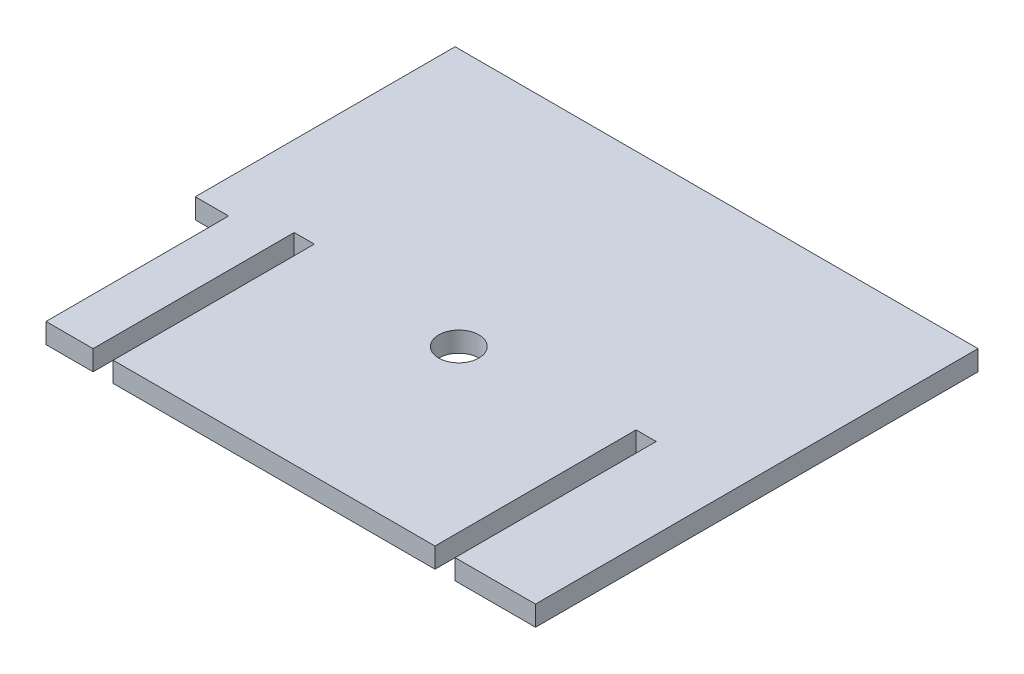
from build123d import *

# Parameters (mm, degrees)
BOSS_EXTRUDE1_DEPTH = 12.7
CAVITY1_START       = 298.45
CAVITY1_OUTLINE_R   = 12.7
CAVITY1_DEPTH       = 12.7
CAVITY1_START_2     = 720.91620239
CAVITY1_2_DEPTH     = 22.43918751
SKETCH2_W           = 21.068746236
SKETCH2_H           = 115.32536453
CUT_EXTRUDE1_DEPTH  = 1143.349273427


# Read off the part's stored shape, not the designer's step: Cavity1
with BuildPart() as part:
    # Sketch1 → Boss-Extrude1 (new body)
    with BuildSketch(Plane(origin=(0, 298.45, 0), x_dir=(-1, 0, 0), z_dir=(0, -1, 0))):
        Polygon((-798.4, 260.35), (-798.4, 133.35), (-1001.6, 133.35), (-1001.6, 260.35), (-1014.3, 260.35), (-1014.3, 133.35), (-1065.1, 133.35), (-1065.1, 412.75), (-1014.3, 412.75), (-1001.6, 412.75), (-798.4, 412.75), (-785.7, 412.75), (-734.9, 412.75), (-734.9, 133.35), (-785.7, 133.35), (-785.7, 260.35), align=None)
    extrude(amount=-BOSS_EXTRUDE1_DEPTH)

    # Cavity1 outline → Cavity1 (cut)
    with BuildSketch(Plane(origin=(0, 0, 0), x_dir=(1, 0, 0), z_dir=(0, 1, 0)).offset(CAVITY1_START)):
        with Locations((900, 250)):
            Circle(CAVITY1_OUTLINE_R)
    extrude(amount=CAVITY1_DEPTH, mode=Mode.SUBTRACT)

    # Cavity1 2 outline → Cavity1 2 (cut)
    with BuildSketch(Plane(origin=(0, 0, 0), x_dir=(0.7149295353100682, -0.6987525164445135, -0.024913456279483565), z_dir=(0.6991965099607762, 0.7144755512387232, 0.02547404837855681)).offset(CAVITY1_START_2)):
        with BuildLine():
            ThreePointArc((313.444242413, 230.081087528), (327.146171675, 242.424687318), (314.076314529, 255.435688643))
            Line((314.076314529, 255.435688643), (312, 255.374549574))
            Line((312, 255.374549574), (312, 230.195835843))
            Line((312, 230.195835843), (313.444242413, 230.081087528))
        make_face()
    extrude(amount=CAVITY1_2_DEPTH, mode=Mode.SUBTRACT)

    # Sketch2 → Cut-Extrude1 (cut, through all)
    with BuildSketch(Plane(origin=(0, 311.15, 0), x_dir=(1, 0, 0), z_dir=(0, 1, 0))):
        with Locations((745.434373118, 191.012682265)):
            Rectangle(SKETCH2_W, SKETCH2_H)
    extrude(amount=-CUT_EXTRUDE1_DEPTH, mode=Mode.SUBTRACT)


solid = part.part
